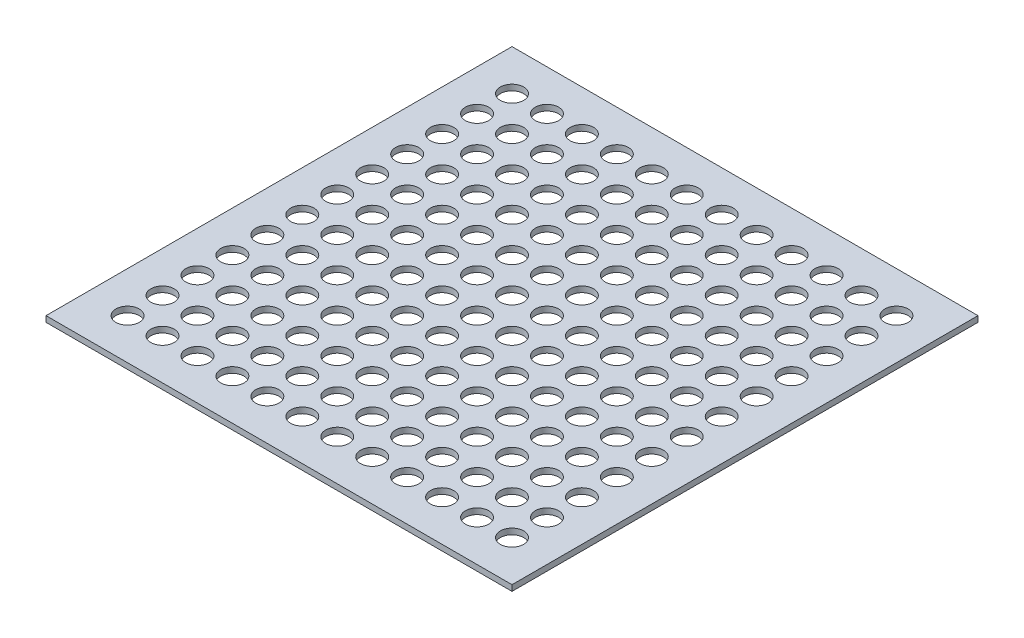
from build123d import *

# Parameters (mm, degrees)
SKETCH1_W           = 400
SKETCH1_H           = 400
SKETCH1_R           = 10
BOSS_EXTRUDE1_DEPTH = 5


with BuildPart() as part:
    # Sketch1 → Boss-Extrude1 (new body)
    with BuildSketch(Plane(origin=(0, 0, 0), x_dir=(1, 0, 0), z_dir=(0, 1, 0))):
        with Locations((200, 200)):
            Rectangle(SKETCH1_W, SKETCH1_H)
        with Locations((35, 35)):
            Circle(SKETCH1_R, mode=Mode.SUBTRACT)
        with Locations((65, 35)):
            Circle(SKETCH1_R, mode=Mode.SUBTRACT)
        with Locations((95, 35)):
            Circle(SKETCH1_R, mode=Mode.SUBTRACT)
        with Locations((35, 65)):
            Circle(SKETCH1_R, mode=Mode.SUBTRACT)
        with Locations((35, 95)):
            Circle(SKETCH1_R, mode=Mode.SUBTRACT)
        with Locations((65, 65)):
            Circle(SKETCH1_R, mode=Mode.SUBTRACT)
        with Locations((95, 65)):
            Circle(SKETCH1_R, mode=Mode.SUBTRACT)
        with Locations((65, 95)):
            Circle(SKETCH1_R, mode=Mode.SUBTRACT)
        with Locations((95, 95)):
            Circle(SKETCH1_R, mode=Mode.SUBTRACT)
        with Locations((125, 35)):
            Circle(SKETCH1_R, mode=Mode.SUBTRACT)
        with Locations((155, 35)):
            Circle(SKETCH1_R, mode=Mode.SUBTRACT)
        with Locations((185, 35)):
            Circle(SKETCH1_R, mode=Mode.SUBTRACT)
        with Locations((125, 65)):
            Circle(SKETCH1_R, mode=Mode.SUBTRACT)
        with Locations((125, 95)):
            Circle(SKETCH1_R, mode=Mode.SUBTRACT)
        with Locations((155, 65)):
            Circle(SKETCH1_R, mode=Mode.SUBTRACT)
        with Locations((185, 65)):
            Circle(SKETCH1_R, mode=Mode.SUBTRACT)
        with Locations((155, 95)):
            Circle(SKETCH1_R, mode=Mode.SUBTRACT)
        with Locations((185, 95)):
            Circle(SKETCH1_R, mode=Mode.SUBTRACT)
        with Locations((35, 125)):
            Circle(SKETCH1_R, mode=Mode.SUBTRACT)
        with Locations((65, 125)):
            Circle(SKETCH1_R, mode=Mode.SUBTRACT)
        with Locations((95, 125)):
            Circle(SKETCH1_R, mode=Mode.SUBTRACT)
        with Locations((35, 155)):
            Circle(SKETCH1_R, mode=Mode.SUBTRACT)
        with Locations((35, 185)):
            Circle(SKETCH1_R, mode=Mode.SUBTRACT)
        with Locations((65, 155)):
            Circle(SKETCH1_R, mode=Mode.SUBTRACT)
        with Locations((95, 155)):
            Circle(SKETCH1_R, mode=Mode.SUBTRACT)
        with Locations((65, 185)):
            Circle(SKETCH1_R, mode=Mode.SUBTRACT)
        with Locations((95, 185)):
            Circle(SKETCH1_R, mode=Mode.SUBTRACT)
        with Locations((125, 125)):
            Circle(SKETCH1_R, mode=Mode.SUBTRACT)
        with Locations((155, 125)):
            Circle(SKETCH1_R, mode=Mode.SUBTRACT)
        with Locations((185, 125)):
            Circle(SKETCH1_R, mode=Mode.SUBTRACT)
        with Locations((125, 155)):
            Circle(SKETCH1_R, mode=Mode.SUBTRACT)
        with Locations((125, 185)):
            Circle(SKETCH1_R, mode=Mode.SUBTRACT)
        with Locations((155, 155)):
            Circle(SKETCH1_R, mode=Mode.SUBTRACT)
        with Locations((185, 155)):
            Circle(SKETCH1_R, mode=Mode.SUBTRACT)
        with Locations((155, 185)):
            Circle(SKETCH1_R, mode=Mode.SUBTRACT)
        with Locations((185, 185)):
            Circle(SKETCH1_R, mode=Mode.SUBTRACT)
        with Locations((215, 35)):
            Circle(SKETCH1_R, mode=Mode.SUBTRACT)
        with Locations((245, 35)):
            Circle(SKETCH1_R, mode=Mode.SUBTRACT)
        with Locations((275, 35)):
            Circle(SKETCH1_R, mode=Mode.SUBTRACT)
        with Locations((215, 65)):
            Circle(SKETCH1_R, mode=Mode.SUBTRACT)
        with Locations((245, 65)):
            Circle(SKETCH1_R, mode=Mode.SUBTRACT)
        with Locations((215, 95)):
            Circle(SKETCH1_R, mode=Mode.SUBTRACT)
        with Locations((245, 95)):
            Circle(SKETCH1_R, mode=Mode.SUBTRACT)
        with Locations((275, 65)):
            Circle(SKETCH1_R, mode=Mode.SUBTRACT)
        with Locations((275, 95)):
            Circle(SKETCH1_R, mode=Mode.SUBTRACT)
        with Locations((305, 35)):
            Circle(SKETCH1_R, mode=Mode.SUBTRACT)
        with Locations((335, 35)):
            Circle(SKETCH1_R, mode=Mode.SUBTRACT)
        with Locations((365, 35)):
            Circle(SKETCH1_R, mode=Mode.SUBTRACT)
        with Locations((305, 65)):
            Circle(SKETCH1_R, mode=Mode.SUBTRACT)
        with Locations((335, 65)):
            Circle(SKETCH1_R, mode=Mode.SUBTRACT)
        with Locations((305, 95)):
            Circle(SKETCH1_R, mode=Mode.SUBTRACT)
        with Locations((335, 95)):
            Circle(SKETCH1_R, mode=Mode.SUBTRACT)
        with Locations((365, 65)):
            Circle(SKETCH1_R, mode=Mode.SUBTRACT)
        with Locations((365, 95)):
            Circle(SKETCH1_R, mode=Mode.SUBTRACT)
        with Locations((215, 125)):
            Circle(SKETCH1_R, mode=Mode.SUBTRACT)
        with Locations((245, 125)):
            Circle(SKETCH1_R, mode=Mode.SUBTRACT)
        with Locations((275, 125)):
            Circle(SKETCH1_R, mode=Mode.SUBTRACT)
        with Locations((215, 155)):
            Circle(SKETCH1_R, mode=Mode.SUBTRACT)
        with Locations((245, 155)):
            Circle(SKETCH1_R, mode=Mode.SUBTRACT)
        with Locations((215, 185)):
            Circle(SKETCH1_R, mode=Mode.SUBTRACT)
        with Locations((245, 185)):
            Circle(SKETCH1_R, mode=Mode.SUBTRACT)
        with Locations((275, 155)):
            Circle(SKETCH1_R, mode=Mode.SUBTRACT)
        with Locations((275, 185)):
            Circle(SKETCH1_R, mode=Mode.SUBTRACT)
        with Locations((305, 125)):
            Circle(SKETCH1_R, mode=Mode.SUBTRACT)
        with Locations((335, 125)):
            Circle(SKETCH1_R, mode=Mode.SUBTRACT)
        with Locations((365, 125)):
            Circle(SKETCH1_R, mode=Mode.SUBTRACT)
        with Locations((305, 155)):
            Circle(SKETCH1_R, mode=Mode.SUBTRACT)
        with Locations((335, 155)):
            Circle(SKETCH1_R, mode=Mode.SUBTRACT)
        with Locations((305, 185)):
            Circle(SKETCH1_R, mode=Mode.SUBTRACT)
        with Locations((335, 185)):
            Circle(SKETCH1_R, mode=Mode.SUBTRACT)
        with Locations((365, 155)):
            Circle(SKETCH1_R, mode=Mode.SUBTRACT)
        with Locations((365, 185)):
            Circle(SKETCH1_R, mode=Mode.SUBTRACT)
        with Locations((35, 215)):
            Circle(SKETCH1_R, mode=Mode.SUBTRACT)
        with Locations((35, 245)):
            Circle(SKETCH1_R, mode=Mode.SUBTRACT)
        with Locations((65, 215)):
            Circle(SKETCH1_R, mode=Mode.SUBTRACT)
        with Locations((95, 215)):
            Circle(SKETCH1_R, mode=Mode.SUBTRACT)
        with Locations((65, 245)):
            Circle(SKETCH1_R, mode=Mode.SUBTRACT)
        with Locations((95, 245)):
            Circle(SKETCH1_R, mode=Mode.SUBTRACT)
        with Locations((35, 275)):
            Circle(SKETCH1_R, mode=Mode.SUBTRACT)
        with Locations((65, 275)):
            Circle(SKETCH1_R, mode=Mode.SUBTRACT)
        with Locations((95, 275)):
            Circle(SKETCH1_R, mode=Mode.SUBTRACT)
        with Locations((125, 215)):
            Circle(SKETCH1_R, mode=Mode.SUBTRACT)
        with Locations((125, 245)):
            Circle(SKETCH1_R, mode=Mode.SUBTRACT)
        with Locations((155, 215)):
            Circle(SKETCH1_R, mode=Mode.SUBTRACT)
        with Locations((185, 215)):
            Circle(SKETCH1_R, mode=Mode.SUBTRACT)
        with Locations((155, 245)):
            Circle(SKETCH1_R, mode=Mode.SUBTRACT)
        with Locations((185, 245)):
            Circle(SKETCH1_R, mode=Mode.SUBTRACT)
        with Locations((125, 275)):
            Circle(SKETCH1_R, mode=Mode.SUBTRACT)
        with Locations((155, 275)):
            Circle(SKETCH1_R, mode=Mode.SUBTRACT)
        with Locations((185, 275)):
            Circle(SKETCH1_R, mode=Mode.SUBTRACT)
        with Locations((35, 305)):
            Circle(SKETCH1_R, mode=Mode.SUBTRACT)
        with Locations((35, 335)):
            Circle(SKETCH1_R, mode=Mode.SUBTRACT)
        with Locations((65, 305)):
            Circle(SKETCH1_R, mode=Mode.SUBTRACT)
        with Locations((95, 305)):
            Circle(SKETCH1_R, mode=Mode.SUBTRACT)
        with Locations((65, 335)):
            Circle(SKETCH1_R, mode=Mode.SUBTRACT)
        with Locations((95, 335)):
            Circle(SKETCH1_R, mode=Mode.SUBTRACT)
        with Locations((35, 365)):
            Circle(SKETCH1_R, mode=Mode.SUBTRACT)
        with Locations((65, 365)):
            Circle(SKETCH1_R, mode=Mode.SUBTRACT)
        with Locations((95, 365)):
            Circle(SKETCH1_R, mode=Mode.SUBTRACT)
        with Locations((125, 305)):
            Circle(SKETCH1_R, mode=Mode.SUBTRACT)
        with Locations((125, 335)):
            Circle(SKETCH1_R, mode=Mode.SUBTRACT)
        with Locations((155, 305)):
            Circle(SKETCH1_R, mode=Mode.SUBTRACT)
        with Locations((185, 305)):
            Circle(SKETCH1_R, mode=Mode.SUBTRACT)
        with Locations((155, 335)):
            Circle(SKETCH1_R, mode=Mode.SUBTRACT)
        with Locations((185, 335)):
            Circle(SKETCH1_R, mode=Mode.SUBTRACT)
        with Locations((125, 365)):
            Circle(SKETCH1_R, mode=Mode.SUBTRACT)
        with Locations((155, 365)):
            Circle(SKETCH1_R, mode=Mode.SUBTRACT)
        with Locations((185, 365)):
            Circle(SKETCH1_R, mode=Mode.SUBTRACT)
        with Locations((215, 215)):
            Circle(SKETCH1_R, mode=Mode.SUBTRACT)
        with Locations((245, 215)):
            Circle(SKETCH1_R, mode=Mode.SUBTRACT)
        with Locations((215, 245)):
            Circle(SKETCH1_R, mode=Mode.SUBTRACT)
        with Locations((245, 245)):
            Circle(SKETCH1_R, mode=Mode.SUBTRACT)
        with Locations((275, 215)):
            Circle(SKETCH1_R, mode=Mode.SUBTRACT)
        with Locations((275, 245)):
            Circle(SKETCH1_R, mode=Mode.SUBTRACT)
        with Locations((215, 275)):
            Circle(SKETCH1_R, mode=Mode.SUBTRACT)
        with Locations((245, 275)):
            Circle(SKETCH1_R, mode=Mode.SUBTRACT)
        with Locations((275, 275)):
            Circle(SKETCH1_R, mode=Mode.SUBTRACT)
        with Locations((305, 215)):
            Circle(SKETCH1_R, mode=Mode.SUBTRACT)
        with Locations((335, 215)):
            Circle(SKETCH1_R, mode=Mode.SUBTRACT)
        with Locations((305, 245)):
            Circle(SKETCH1_R, mode=Mode.SUBTRACT)
        with Locations((335, 245)):
            Circle(SKETCH1_R, mode=Mode.SUBTRACT)
        with Locations((365, 215)):
            Circle(SKETCH1_R, mode=Mode.SUBTRACT)
        with Locations((365, 245)):
            Circle(SKETCH1_R, mode=Mode.SUBTRACT)
        with Locations((305, 275)):
            Circle(SKETCH1_R, mode=Mode.SUBTRACT)
        with Locations((335, 275)):
            Circle(SKETCH1_R, mode=Mode.SUBTRACT)
        with Locations((365, 275)):
            Circle(SKETCH1_R, mode=Mode.SUBTRACT)
        with Locations((215, 305)):
            Circle(SKETCH1_R, mode=Mode.SUBTRACT)
        with Locations((245, 305)):
            Circle(SKETCH1_R, mode=Mode.SUBTRACT)
        with Locations((215, 335)):
            Circle(SKETCH1_R, mode=Mode.SUBTRACT)
        with Locations((245, 335)):
            Circle(SKETCH1_R, mode=Mode.SUBTRACT)
        with Locations((275, 305)):
            Circle(SKETCH1_R, mode=Mode.SUBTRACT)
        with Locations((275, 335)):
            Circle(SKETCH1_R, mode=Mode.SUBTRACT)
        with Locations((215, 365)):
            Circle(SKETCH1_R, mode=Mode.SUBTRACT)
        with Locations((245, 365)):
            Circle(SKETCH1_R, mode=Mode.SUBTRACT)
        with Locations((275, 365)):
            Circle(SKETCH1_R, mode=Mode.SUBTRACT)
        with Locations((305, 305)):
            Circle(SKETCH1_R, mode=Mode.SUBTRACT)
        with Locations((335, 305)):
            Circle(SKETCH1_R, mode=Mode.SUBTRACT)
        with Locations((305, 335)):
            Circle(SKETCH1_R, mode=Mode.SUBTRACT)
        with Locations((335, 335)):
            Circle(SKETCH1_R, mode=Mode.SUBTRACT)
        with Locations((365, 305)):
            Circle(SKETCH1_R, mode=Mode.SUBTRACT)
        with Locations((365, 335)):
            Circle(SKETCH1_R, mode=Mode.SUBTRACT)
        with Locations((305, 365)):
            Circle(SKETCH1_R, mode=Mode.SUBTRACT)
        with Locations((335, 365)):
            Circle(SKETCH1_R, mode=Mode.SUBTRACT)
        with Locations((365, 365)):
            Circle(SKETCH1_R, mode=Mode.SUBTRACT)
    extrude(amount=BOSS_EXTRUDE1_DEPTH)


solid = part.part
